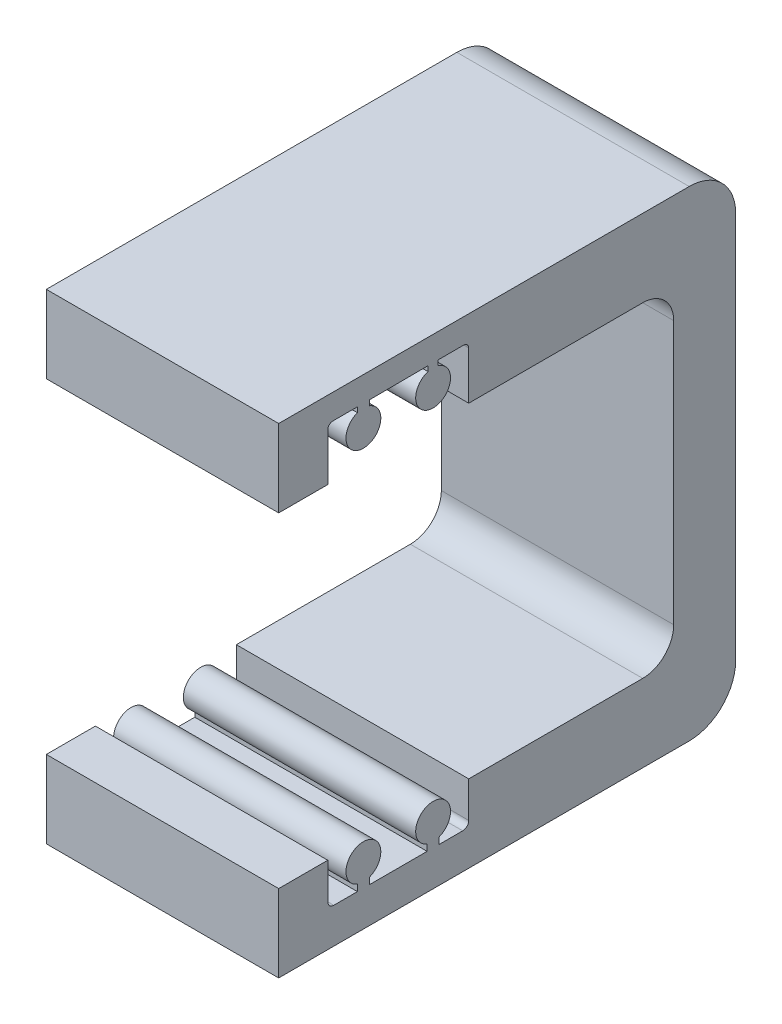
from build123d import *

# Parameters (mm, degrees)
ESBO_O1_W                  = 30
ESBO_O1_H                  = 10
RESSALTO_EXTRUS_O1_DEPTH   = 59
RESSALTO_EXTRUS_O1_2_DEPTH = 59
ESBO_O2_W                  = 30
ESBO_O2_H                  = 42
RESSALTO_EXTRUS_O2_DEPTH   = 8
CORTE_EXTRUS_O1_DEPTH      = 74.088986858
CORTE_EXTRUS_O2_DEPTH      = 4
FILETE1_R                  = 4
ESBO_O5_R                  = 2.5
CORTE_EXTRUS_O3_DEPTH      = 5
FILETE2_R                  = 6


with BuildPart() as part:
    # Esboço1 → Ressalto-extrusão1 (new body)
    with BuildSketch(Plane.XY):
        with Locations((0, 26)):
            Rectangle(ESBO_O1_W, ESBO_O1_H)
    extrude(amount=RESSALTO_EXTRUS_O1_DEPTH)



with BuildPart() as body_2:
    # Esboço1 → Ressalto-extrus_o1 2 (new body)
    with BuildSketch(Plane.XY):
        with Locations((0, -26)):
            Rectangle(ESBO_O1_W, ESBO_O1_H)
    extrude(amount=RESSALTO_EXTRUS_O1_2_DEPTH)


with BuildPart() as part_1:
    add(part.part)

    add(body_2.part)  # Ressalto-extrusão2 merges body 2
    # Esboço2 → Ressalto-extrusão2 (add)
    with BuildSketch(Plane(origin=(0, 0, 0), x_dir=(-1, 0, 0), z_dir=(0, 0, -1))):
        Rectangle(ESBO_O2_W, ESBO_O2_H)
    extrude(amount=-RESSALTO_EXTRUS_O2_DEPTH)

    # Esboço3 → Corte-extrusão1 (cut, through all)
    with BuildSketch(Plane.ZY.offset(15)):
        with BuildLine():
            Line((34.464319348, 27.180824333), (34.464319348, 21))
            Line((34.464319348, 21), (52.664319348, 21))
            Line((52.664319348, 21), (52.664319348, 27.13384671))
            ThreePointArc((52.664319348, 27.13384671), (52.473932816, 27.593480457), (52.014299068, 27.783866989))
            Line((52.014299068, 27.783866989), (48.83365389, 27.783866989))
            Line((48.83365389, 27.783866989), (48.853388433, 27.775806736))
            Line((48.853388433, 27.775806736), (48.83365389, 27.775908805))
            Line((48.83365389, 27.775908805), (48.83365389, 27.124623249))
            ThreePointArc((48.83365389, 27.124623249), (48.064319348, 22.760238146), (47.294984805, 27.124623249))
            Line((47.294984805, 27.124623249), (47.294984805, 27.783866989))
            Line((47.294984805, 27.783866989), (40.021105511, 27.821488377))
            Line((40.021105511, 27.821488377), (39.721105511, 27.821488377))
            Line((39.721105511, 27.821488377), (39.721105511, 27.162244637))
            ThreePointArc((39.721105511, 27.162244637), (39.064319348, 22.760238146), (38.407533184, 27.162244637))
            Line((38.407533184, 27.162244637), (38.407533184, 27.821488377))
            Line((38.407533184, 27.821488377), (35.104983392, 27.821488377))
            ThreePointArc((35.104983392, 27.821488377), (34.654639493, 27.631168232), (34.464319348, 27.180824333))
        make_face()
        with BuildLine():
            ThreePointArc((51.8897547, -26.423845407), (52.437454615, -26.196980674), (52.664319348, -25.649280759))
            Line((52.664319348, -25.649280759), (52.664319348, -21))
            Line((52.664319348, -21), (34.464319348, -21))
            Line((34.464319348, -21), (34.464319348, -25.649280759))
            ThreePointArc((34.464319348, -25.649280759), (34.69118408, -26.196980674), (35.238883995, -26.423845407))
            Line((35.238883995, -26.423845407), (38.294984805, -26.423845407))
            Line((38.294984805, -26.423845407), (38.294984805, -25.584623249))
            ThreePointArc((38.294984805, -25.584623249), (39.064319348, -21.220238146), (39.83365389, -25.584623249))
            Line((39.83365389, -25.584623249), (39.83365389, -26.423845407))
            Line((39.83365389, -26.423845407), (47.294984805, -26.423845407))
            Line((47.294984805, -26.423845407), (47.294984805, -25.584623249))
            ThreePointArc((47.294984805, -25.584623249), (48.064319348, -21.220238146), (48.83365389, -25.584623249))
            Line((48.83365389, -25.584623249), (48.83365389, -26.423845407))
            Line((48.83365389, -26.423845407), (51.8897547, -26.423845407))
        make_face()
    extrude(amount=-CORTE_EXTRUS_O1_DEPTH, mode=Mode.SUBTRACT)

    # Esboço4 → Corte-extrusão2 (cut)
    with BuildSketch(Plane.ZY.offset(15)):
        with BuildLine():
            Line((47.294984805, 27.783866989), (48.853388433, 27.775806736))
            Line((48.853388433, 27.775806736), (48.853388433, 27.117338044))
            ThreePointArc((48.853388433, 27.117338044), (48.055619332, 22.760254966), (47.291568671, 27.123377136))
            Line((47.291568671, 27.123377136), (47.294984805, 27.783866989))
        make_face()
        with BuildLine():
            Line((38.407533184, 27.821488377), (38.407533184, 27.162244637))
            ThreePointArc((38.407533184, 27.162244637), (39.064319348, 22.760238146), (39.721105511, 27.162244637))
            Line((39.721105511, 27.162244637), (39.721105511, 27.821488377))
            Line((39.721105511, 27.821488377), (38.407533184, 27.821488377))
        make_face()
    extrude(amount=-CORTE_EXTRUS_O2_DEPTH, mode=Mode.SUBTRACT)

    # Filete1
    filete1_edges = [part_1.edges().sort_by_distance(p)[0] for p in [
        (0, 21, 8),
        (0, -21, 8),
    ]]
    fillet(filete1_edges, radius=FILETE1_R)

    # Esboço5 → Corte-extrusão3 (cut)
    with BuildSketch(Plane(origin=(0, 0, 0), x_dir=(-1, 0, 0), z_dir=(0, 0, -1))):
        with Locations((0, -12)):
            Circle(ESBO_O5_R)
        with Locations((0, 12)):
            Circle(ESBO_O5_R)
    extrude(amount=-CORTE_EXTRUS_O3_DEPTH, mode=Mode.SUBTRACT)

    # Filete2
    filete2_edges = [part_1.edges().sort_by_distance(p)[0] for p in [
        (0, -31, 0),
        (0, 31, 0),
    ]]
    fillet(filete2_edges, radius=FILETE2_R)


solid = part_1.part
